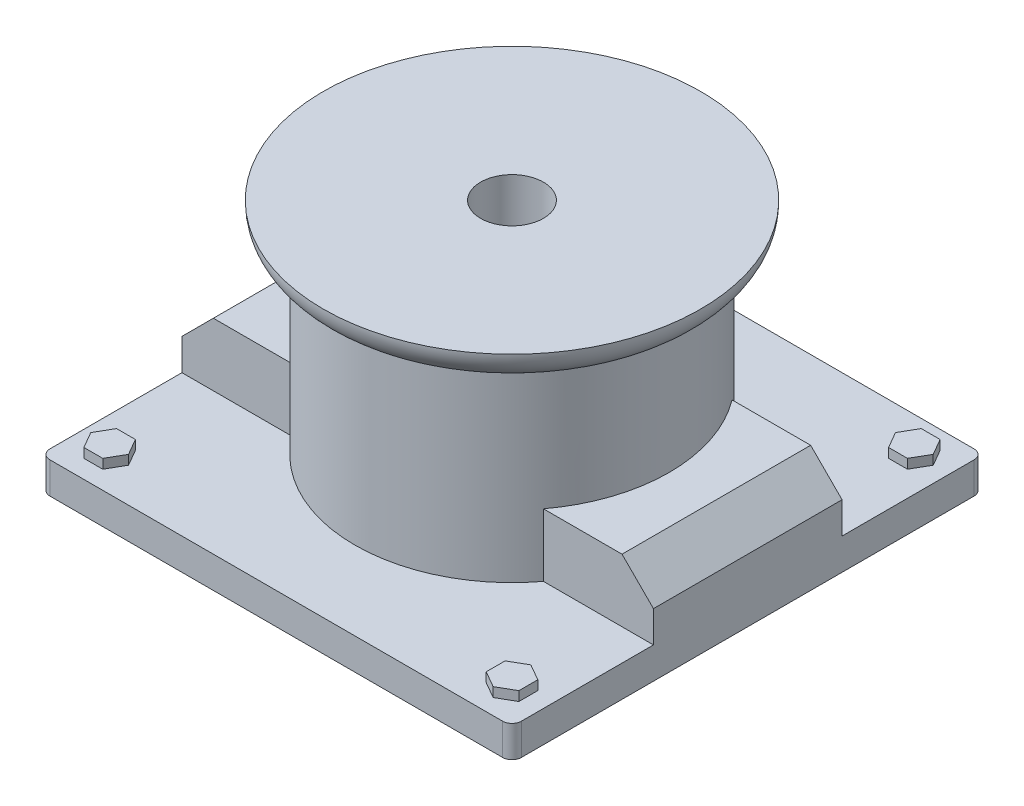
from build123d import *

# Parameters (mm, degrees)
SKETCH1_W           = 150
SKETCH1_H           = 150
BOSS_EXTRUDE1_DEPTH = 10
SKETCH2_R           = 50
BOSS_EXTRUDE2_DEPTH = 60
SKETCH3_R           = 60
BOSS_EXTRUDE3_DEPTH = 10
SKETCH7_W           = 150
SKETCH7_H           = 60
BOSS_EXTRUDE6_DEPTH = 30
SKETCH8_R           = 10
CUT_EXTRUDE2_DEPTH  = 20
FILLET3_R           = 10
FILLET4_R           = 3
CHAMFER1_SIZE       = 10
BOSS_EXTRUDE7_DEPTH = 3
CIRPATTERN1_COUNT   = 4


with BuildPart() as part:
    # Sketch1 → Boss-Extrude1 (new body)
    with BuildSketch(Plane(origin=(0, 0, 0), x_dir=(1, 0, 0), z_dir=(0, 1, 0))):
        Rectangle(SKETCH1_W, SKETCH1_H)
    extrude(amount=BOSS_EXTRUDE1_DEPTH)

    # Sketch2 → Boss-Extrude2 (add)
    with BuildSketch(Plane(origin=(0, 10, 0), x_dir=(1, 0, 0), z_dir=(0, 1, 0))):
        with Locations(Location((0, 0, 0), (0, 0, 270))):
            Circle(SKETCH2_R)
    extrude(amount=BOSS_EXTRUDE2_DEPTH)

    # Sketch3 → Boss-Extrude3 (add)
    with BuildSketch(Plane(origin=(0, 70, 0), x_dir=(1, 0, 0), z_dir=(0, 1, 0))):
        with Locations(Location((0, 0, 0), (0, 0, 270))):
            Circle(SKETCH3_R)
    extrude(amount=BOSS_EXTRUDE3_DEPTH)

    # Sketch7 → Boss-Extrude6 (add)
    with BuildSketch(Plane(origin=(0, 0, 0), x_dir=(-1, 0, 0), z_dir=(0, -1, 0))):
        Rectangle(SKETCH7_W, SKETCH7_H)
    extrude(amount=-BOSS_EXTRUDE6_DEPTH)

    # Sketch8 → Cut-Extrude2 (cut)
    with BuildSketch(Plane(origin=(0, 80, 0), x_dir=(1, 0, 0), z_dir=(0, 1, 0))):
        with Locations(Location((0, 0, 0), (0, 0, 270))):
            Circle(SKETCH8_R)
    extrude(amount=-CUT_EXTRUDE2_DEPTH, mode=Mode.SUBTRACT)

    # Fillet3
    fillet3_edges = [part.edges().sort_by_distance(p)[0] for p in [
        (0, 70, -60),
    ]]
    fillet(fillet3_edges, radius=FILLET3_R - 0.0001)  # a hair under: the kernel refuses the full size

    # Fillet4
    fillet4_edges = [part.edges().sort_by_distance(p)[0] for p in [
        (75, 5, 75),
        (-75, 5, 75),
        (-75, 5, -75),
        (75, 5, -75),
    ]]
    fillet(fillet4_edges, radius=FILLET4_R)

    # Chamfer1
    chamfer1_edges = [part.edges().sort_by_distance(p)[0] for p in [
        (75, 30, 0),
        (-75, 30, 0),
    ]]
    chamfer(chamfer1_edges, length=CHAMFER1_SIZE)

    # Sketch9 → Boss-Extrude7 (add)
    with BuildSketch(Plane(origin=(0, 10, 0), x_dir=(1, 0, 0), z_dir=(0, 1, 0))):
        Polygon((-57.993107668, -63.993107668), (-60.993107668, -58.796955246), (-66.993107668, -58.796955246), (-69.993107668, -63.993107668), (-66.993107668, -69.189260091), (-60.993107668, -69.189260091), align=None)
    boss_extrude7 = extrude(amount=BOSS_EXTRUDE7_DEPTH)

    # CirPattern1: Boss-Extrude7 ×4 about axis
    cirpattern1_axis = Axis((0, 0, 0), (0, 1, 0))
    for i in range(1, CIRPATTERN1_COUNT):
        add(boss_extrude7.rotate(cirpattern1_axis, i * 360 / CIRPATTERN1_COUNT))


solid = part.part
